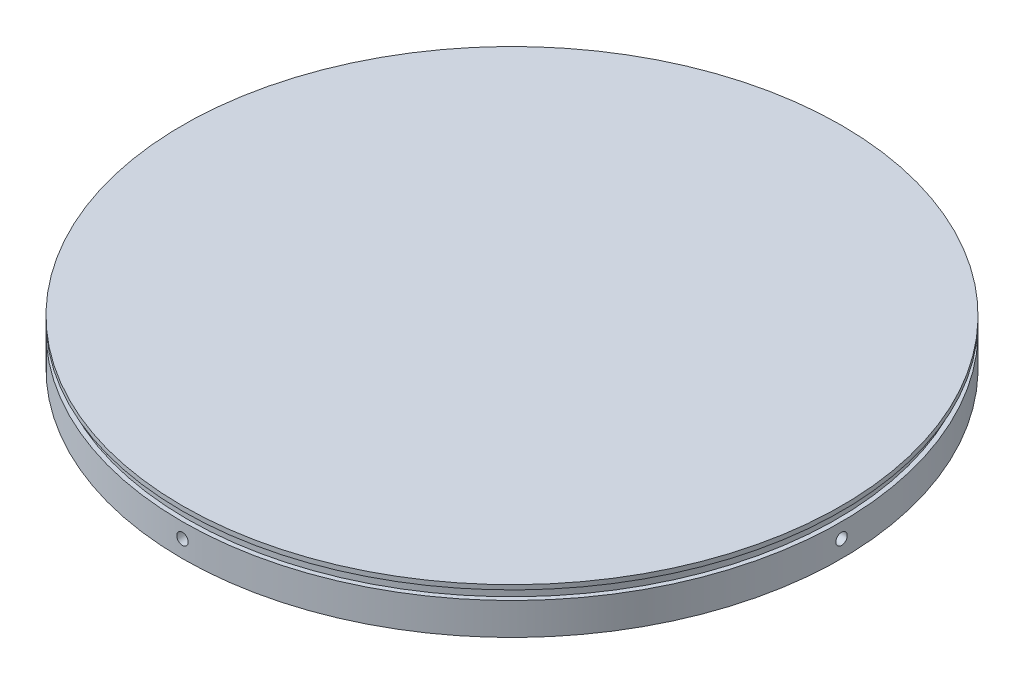
from build123d import *

# Parameters (mm, degrees)
SKETCH_9_R               = 72
SKETCH_9_R_2             = 70
EXTRUDE_9_DEPTH          = 10
SKETCH_9_18_R            = 70
SKETCH_9_18_R_2          = 66
EXTRUDE_10_DEPTH         = 2.5
SKETCH_9_19_R            = 66
EXTRUDE_11_DEPTH         = 10
SHELL_START              = -10
SHELL_2_OUTLINE_R        = 64
SHELL_2_DEPTH            = 8
F_2_5MM_1_REACH          = 163.118
F_2_5MM_1_BORE_R         = 1.25
PATTERN_CIRCULAR_1_COUNT = 4
SKETCH_15_W              = 1
SKETCH_15_H              = 2


# Read off the part's stored shape, not the designer's step: 薄殼2
with BuildPart() as part:
    # 草圖9 → 填料-伸長9 (new body)
    with BuildSketch(Plane(origin=(0, 0, 0), x_dir=(1, 0, 0), z_dir=(0, 1, 0))):
        with Locations(Location((0, 0, 0), (0, 0, 270))):
            Circle(SKETCH_9_R)
        with Locations(Location((0, 0, 0), (0, 0, 270))):
            Circle(SKETCH_9_R_2, mode=Mode.SUBTRACT)
    extrude(amount=-EXTRUDE_9_DEPTH)

    # 草圖9<18> → 填料-伸長10 (add)
    with BuildSketch(Plane(origin=(0, 0, 0), x_dir=(1, 0, 0), z_dir=(0, 1, 0))):
        with Locations(Location((0, 0, 0), (0, 0, 270))):
            Circle(SKETCH_9_18_R)
        with Locations(Location((0, 0, 0), (0, 0, 270))):
            Circle(SKETCH_9_18_R_2, mode=Mode.SUBTRACT)
    extrude(amount=-EXTRUDE_10_DEPTH)

    # 草圖9<19> → 填料-伸長11 (add)
    with BuildSketch(Plane(origin=(0, 0, 0), x_dir=(1, 0, 0), z_dir=(0, 1, 0))):
        with Locations(Location((0, 0, 0), (0, 0, 270))):
            Circle(SKETCH_9_19_R)
    extrude(amount=-EXTRUDE_11_DEPTH)

    # 薄殼2 outline → 薄殼2 (cut)
    with BuildSketch(Plane(origin=(0, 0, 0), x_dir=(1, 0, 0), z_dir=(0, 1, 0)).offset(SHELL_START)):
        Circle(SHELL_2_OUTLINE_R)
    extrude(amount=SHELL_2_DEPTH, mode=Mode.SUBTRACT)

    # Ø2.5mm 定位孔1 bore (on position points) → Ø2.5mm 定位孔1 (cut, up to next)
    with BuildSketch(Plane(origin=(0, -6.25, 72), x_dir=(1, 0, 0), z_dir=(0, 0, 1)), mode=Mode.PRIVATE) as f_2_5mm_1_sk1:
        Circle(F_2_5MM_1_BORE_R)
    f_2_5mm_1_tool1 = extrude(f_2_5mm_1_sk1.sketch, amount=-F_2_5MM_1_REACH, mode=Mode.PRIVATE) & part.part
    f_2_5mm_1 = f_2_5mm_1_tool1.solids().sort_by_distance((0, -6.25, 72))[0]
    add(f_2_5mm_1, mode=Mode.SUBTRACT)

    # 環狀複製排列1: Ø2.5mm 定位孔1 ×4 about axis
    pattern_circular_1_axis = Axis((0, -10, 0), (0, 1, 0))
    for i in range(1, PATTERN_CIRCULAR_1_COUNT):
        add(f_2_5mm_1.rotate(pattern_circular_1_axis, i * 360 / PATTERN_CIRCULAR_1_COUNT), mode=Mode.SUBTRACT)

    # 草圖15 → 除料-旋轉2 (revolve, cut)
    with BuildSketch(Plane(origin=(0, 0, 0), x_dir=(0, 0, -1), z_dir=(1, 0, 0))):
        with Locations((-71.5, -2)):
            Rectangle(SKETCH_15_W, SKETCH_15_H)
    revolve(axis=Axis((0, 0, 0), (0, -1, 0)), mode=Mode.SUBTRACT)


solid = part.part
